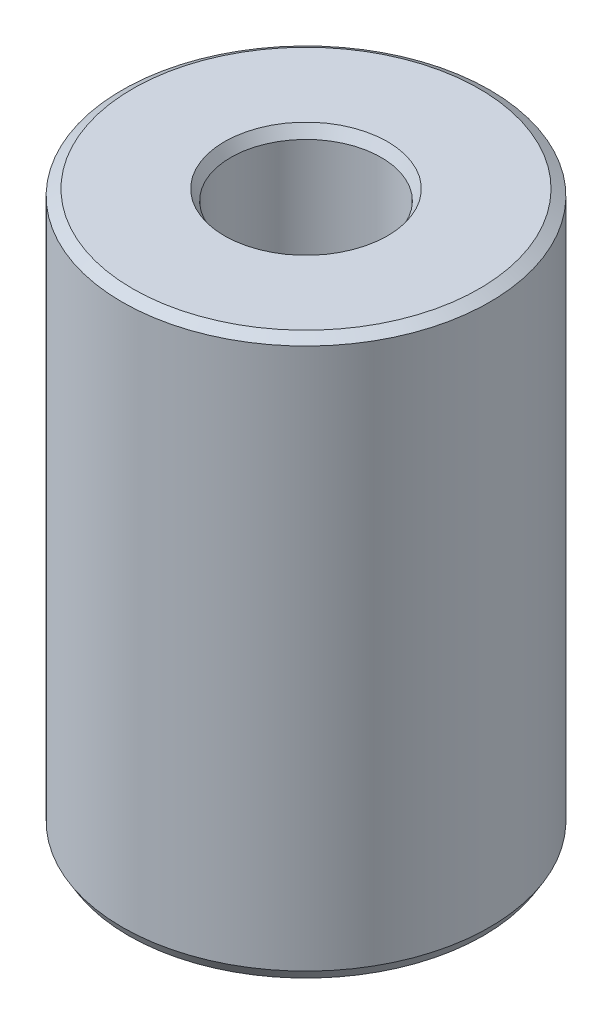
from build123d import *
from OCP.BRepFilletAPI import BRepFilletAPI_MakeChamfer

# Parameters (mm, degrees)
SKETCH1_R           = 17.5
BOSS_EXTRUDE1_DEPTH = 53.14705558
SKETCH2_R           = 7.166485725
CUT_EXTRUDE1_DEPTH  = 59.626866852
CHAMFER1_SIZE       = 0.600748843
CHAMFER1_SIZE2      = 0.99890058


with BuildPart() as part:
    # Sketch1 → Boss-Extrude1 (new body)
    with BuildSketch(Plane(origin=(0, 0, 0), x_dir=(1, 0, 0), z_dir=(0, 1, 0))):
        Circle(SKETCH1_R)
    extrude(amount=BOSS_EXTRUDE1_DEPTH)

    # Sketch2 → Cut-Extrude1 (cut, through all)
    with BuildSketch(Plane(origin=(0, 0, 0), x_dir=(1, 0, 0), z_dir=(0, 1, 0))):
        Circle(SKETCH2_R)
    extrude(amount=CUT_EXTRUDE1_DEPTH, mode=Mode.SUBTRACT)

    # Chamfer1: one chamfer whose edges measure the first distance from different faces: ONE call of the kernel's chamfer builder (chamfer() names one face for all edges)
    chamfer1_edges_1 = [part.edges().sort_by_distance(p)[0] for p in [
        (-7.166485725, 53.14705558, 0),
    ]]
    chamfer1_side_1 = [part.faces().sort_by_distance(p)[0] for p in [
        (-17.005025253, 53.14705558, 0),
    ]]
    chamfer1_edges_2 = [part.edges().sort_by_distance(p)[0] for p in [
        (-7.166485725, 0, 0),
    ]]
    chamfer1_side_2 = [part.faces().sort_by_distance(p)[0] for p in [
        (-7.166485725, 26.57352779, 0),
    ]]
    chamfer1_edges_3 = [part.edges().sort_by_distance(p)[0] for p in [
        (-17.5, 0, 0),
    ]]
    chamfer1_side_3 = [part.faces().sort_by_distance(p)[0] for p in [
        (-17.005025253, 0, 0),
    ]]
    chamfer1_edges_4 = [part.edges().sort_by_distance(p)[0] for p in [
        (-17.5, 53.14705558, 0),
    ]]
    chamfer1_side_4 = [part.faces().sort_by_distance(p)[0] for p in [
        (-17.5, 26.57352779, 0),
    ]]
    chamfer1 = BRepFilletAPI_MakeChamfer(part.part.solid().wrapped)
    for e in chamfer1_edges_1:
        chamfer1.Add(CHAMFER1_SIZE, CHAMFER1_SIZE2, e.wrapped, chamfer1_side_1[0].wrapped)  # the first distance lies on this face
    for e in chamfer1_edges_2:
        chamfer1.Add(CHAMFER1_SIZE, CHAMFER1_SIZE2, e.wrapped, chamfer1_side_2[0].wrapped)  # the first distance lies on this face
    for e in chamfer1_edges_3:
        chamfer1.Add(CHAMFER1_SIZE, CHAMFER1_SIZE2, e.wrapped, chamfer1_side_3[0].wrapped)  # the first distance lies on this face
    for e in chamfer1_edges_4:
        chamfer1.Add(CHAMFER1_SIZE, CHAMFER1_SIZE2, e.wrapped, chamfer1_side_4[0].wrapped)  # the first distance lies on this face
    add(Compound.cast(chamfer1.Shape()), mode=Mode.REPLACE)


solid = part.part
